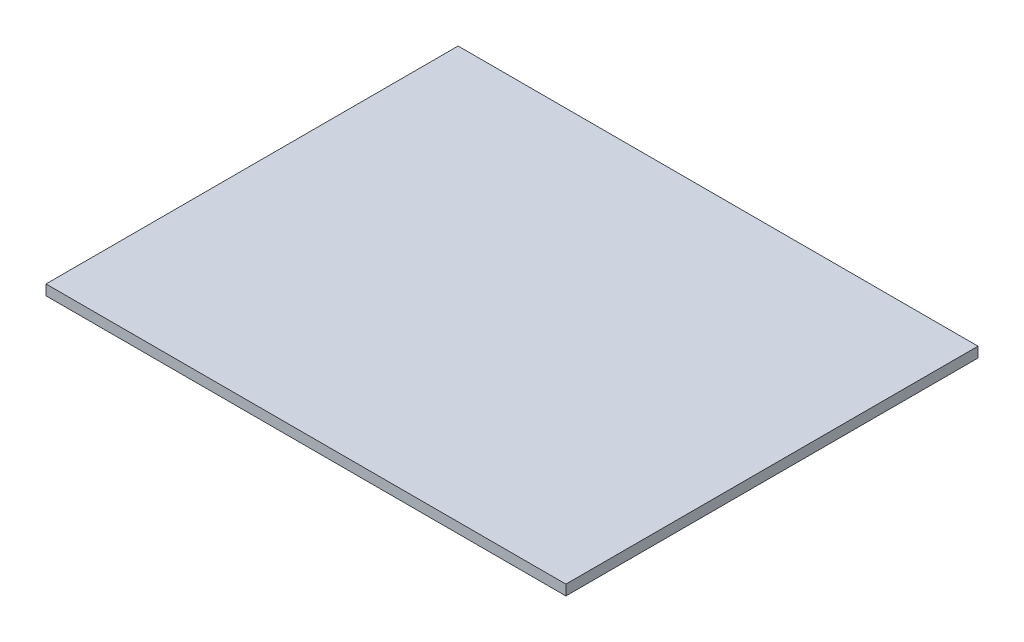
from build123d import *

# Parameters (mm, degrees)
SKETCH1_W           = 480.95
SKETCH1_H           = 9.525
BOSS_EXTRUDE1_DEPTH = 381.25


with BuildPart() as part:
    # Sketch1 → Boss-Extrude1 (new body)
    with BuildSketch(Plane.XY):
        with Locations((0, 114.2875)):
            Rectangle(SKETCH1_W, SKETCH1_H)
    extrude(amount=BOSS_EXTRUDE1_DEPTH)


solid = part.part
